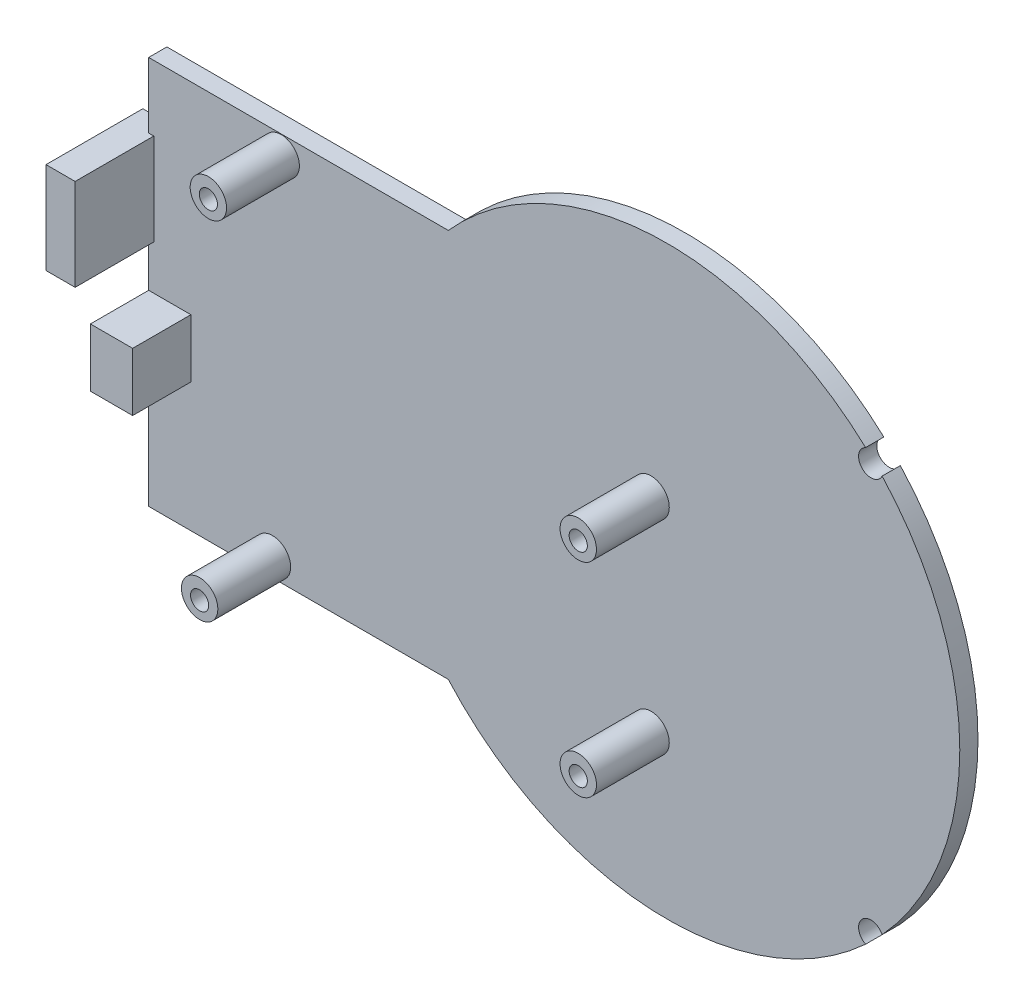
from build123d import *

# Parameters (mm, degrees)
SKETCH2_W           = 51.2
SKETCH2_H           = 53.4
BOSS_EXTRUDE2_DEPTH = 2.5
SKETCH3_R           = 40.2
BOSS_EXTRUDE3_DEPTH = 2.5
SKETCH4_R           = 2.5
BOSS_EXTRUDE4_DEPTH = 10
SKETCH5_W           = 5.8
SKETCH5_H           = 8
BOSS_EXTRUDE5_DEPTH = 8
SKETCH7_R           = 2.1
CUT_EXTRUDE2_DEPTH  = 5.2
SKETCH8_W           = 4
SKETCH8_H           = 12.6
BOSS_EXTRUDE6_DEPTH = 13.3
SKETCH9_R           = 1.25
SKETCH9_R_2         = 1.7
CUT_EXTRUDE4_DEPTH  = 86.692356719


with BuildPart() as part:
    # Sketch2 → Boss-Extrude2 (new body)
    with BuildSketch(Plane.XY.offset(6)):
        with Locations((-45.6, 0)):
            Rectangle(SKETCH2_W, SKETCH2_H)
    extrude(amount=BOSS_EXTRUDE2_DEPTH)

    # Sketch3 → Boss-Extrude3 (add)
    with BuildSketch(Plane.XY.offset(6)):
        Circle(SKETCH3_R)
    extrude(amount=BOSS_EXTRUDE3_DEPTH)

    # Sketch4 → Boss-Extrude4 (add)
    with BuildSketch(Plane.XY.offset(8.5)):
        with Locations((-54.2, -24.17)):
            Circle(SKETCH4_R)
        with Locations((-53, 24.13)):
            Circle(SKETCH4_R)
        with Locations((-2.2, -19.07)):
            Circle(SKETCH4_R)
        with Locations((-2.2, 8.93)):
            Circle(SKETCH4_R)
    extrude(amount=BOSS_EXTRUDE4_DEPTH)

    # Sketch5 → Boss-Extrude5 (add)
    with BuildSketch(Plane.XY.offset(8.5)):
        with Locations((-68.3, -5)):
            Rectangle(SKETCH5_W, SKETCH5_H)
    extrude(amount=BOSS_EXTRUDE5_DEPTH)

    # Sketch7 → Cut-Extrude2 (cut)
    with BuildSketch(Plane(origin=(-71.2, 0, 0), x_dir=(0, 0, -1), z_dir=(1, 0, 0))):
        with Locations((-12.5, -5)):
            Circle(SKETCH7_R)
    extrude(amount=CUT_EXTRUDE2_DEPTH, mode=Mode.SUBTRACT)

    # Sketch8 → Boss-Extrude6 (add)
    with BuildSketch(Plane.XY.offset(6)):
        with Locations((-72.5, 11.4)):
            Rectangle(SKETCH8_W, SKETCH8_H)
    extrude(amount=BOSS_EXTRUDE6_DEPTH)

    # Sketch9 → Cut-Extrude4 (cut, through all)
    with BuildSketch(Plane.XY.offset(6)):
        with Locations((-54.2, -24.37)):
            Circle(SKETCH9_R)
        with Locations((-53, 23.93)):
            Circle(SKETCH9_R)
        with Locations((-2.2, -19.27)):
            Circle(SKETCH9_R)
        with Locations((-2.2, 8.73)):
            Circle(SKETCH9_R)
        with Locations((28, 28)):
            Circle(SKETCH9_R_2)
        with Locations((28, -28)):
            Circle(SKETCH9_R_2)
    extrude(amount=CUT_EXTRUDE4_DEPTH, mode=Mode.SUBTRACT)


solid = part.part
